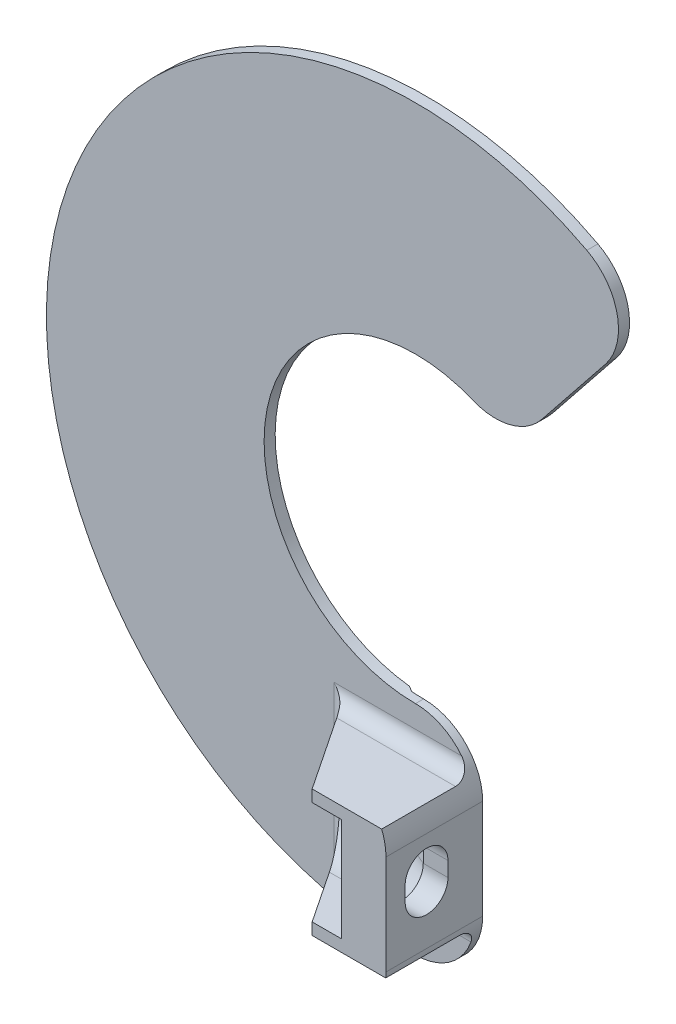
from build123d import *

# Parameters (mm, degrees)
BASE_FLANGE_DEPTH          = 0.75
MOUNT_PEG_DEPTH            = 3
SKETCH4_W                  = 5
SKETCH4_H                  = 8.6
SCREW_BOSS_DEPTH           = 6
SCREW_BOSS_CHAMFER_DEPTH   = 8.6
SCREW_START                = -3
SCREW_BOSS_CLEARANCE_DEPTH = 36.87881814
M2_5_START                 = 1
M2_5_CLEARANCE_SLOT1_DEPTH = 3
PEG_CHAMFER_SIZE           = 0.5
FILLET1_R                  = 1
FILLET2_R                  = 4
SKETCH9_W                  = 5.5
SKETCH9_H                  = 16.180617206
CUT_EXTRUDE1_DEPTH         = 0.2
CHAMFER1_SIZE              = 0.692820323
CHAMFER1_SIZE_2            = 0.4


with BuildPart() as part:
    # Sketch1 → base flange (new body)
    with BuildSketch(Plane.XY):
        with BuildLine():
            Line((4, -24.677925359), (4, -9.442398166))
            ThreePointArc((4, -9.442398166), (-10.158758778, 1.399465338), (6.404113855, 8.009132841))
            Line((6.404113855, 8.009132841), (15.612630109, 19.525516154))
            ThreePointArc((15.612630109, 19.525516154), (-24.179534225, 6.352174798), (4, -24.677925359))
        make_face()
    extrude(amount=BASE_FLANGE_DEPTH)

    # Sketch3 → mount peg (add)
    with BuildSketch(Plane(origin=(0, 0, 0), x_dir=(-1, 0, 0), z_dir=(0, 0, -1))):
        with BuildLine():
            Line((9.575, -19), (9.575, -12))
            ThreePointArc((9.575, -12), (10.75, -10.825), (11.925, -12))
            Line((11.925, -12), (11.925, -19))
            ThreePointArc((11.925, -19), (10.75, -20.175), (9.575, -19))
        make_face()
    extrude(amount=MOUNT_PEG_DEPTH)

    # Sketch4 → screw boss (add)
    with BuildSketch(Plane.XY.offset(0.75)):
        with Locations((1.5, -17.060161762)):
            Rectangle(SKETCH4_W, SKETCH4_H)
    extrude(amount=SCREW_BOSS_DEPTH)

    # Sketch5 → screw boss chamfer (add)
    with BuildSketch(Plane.XZ.offset(21.360161762)):
        Polygon((-1, 0.75), (-1, 6.75), (-5, 0.75), align=None)
    extrude(amount=-SCREW_BOSS_CHAMFER_DEPTH)

    # Sketch6 → screw boss clearance (cut, through all)
    with BuildSketch(Plane(origin=(4, 0, 0), x_dir=(0, 0, -1), z_dir=(1, 0, 0)).offset(SCREW_START)):
        with BuildLine():
            Line((-6.75, -20.560161762), (-3.25, -20.560161762))
            ThreePointArc((-3.25, -20.560161762), (-1.835786438, -19.974375325), (-1.25, -18.560161762))
            Line((-1.25, -18.560161762), (-1.25, -15.560161762))
            ThreePointArc((-1.25, -15.560161762), (-1.835786438, -14.1459482), (-3.25, -13.560161762))
            Line((-3.25, -13.560161762), (-6.75, -13.560161762))
            Line((-6.75, -13.560161762), (-6.75, -20.560161762))
        make_face()
    extrude(amount=-SCREW_BOSS_CLEARANCE_DEPTH, mode=Mode.SUBTRACT)

    # M2.5 Clearance Slot1: read off the stored shape, not the designer's step
    # M2.5 Clearance Slot1 outline → M2.5 Clearance Slot1 (cut)
    with BuildSketch(Plane.YZ.offset(M2_5_START)):
        with BuildLine():
            ThreePointArc((-17.560161762, 5.45), (-19.010161762, 4), (-17.560161762, 2.55))
            Line((-17.560161762, 2.55), (-16.560161762, 2.55))
            ThreePointArc((-16.560161762, 2.55), (-15.110161762, 4), (-16.560161762, 5.45))
            Line((-16.560161762, 5.45), (-17.560161762, 5.45))
        make_face()
    extrude(amount=M2_5_CLEARANCE_SLOT1_DEPTH, mode=Mode.SUBTRACT)

    # M2.5 Clearance Slot1 2: loft between two sections, ruled curve by curve
    m2_5_clearance_slot1_2_from = [
        Edge.make_three_point_arc((2.327817459, -16.560161762, 5.45), (2.327817459, -15.53485693, 5.025304833), (2.327817459, -15.110161762, 4)),
        Edge.make_three_point_arc((2.327817459, -15.110161762, 4), (2.327817459, -15.53485693, 2.974695167), (2.327817459, -16.560161762, 2.55)),
        Edge.make_three_point_arc((2.327817459, -17.560161762, 2.55), (2.327817459, -18.585466595, 2.974695167), (2.327817459, -19.010161762, 4)),
        Edge.make_three_point_arc((2.327817459, -19.010161762, 4), (2.327817459, -18.585466595, 5.025304833), (2.327817459, -17.560161762, 5.45)),
        Edge.make_line((2.327817459, -16.560161762, 2.55), (2.327817459, -17.560161762, 2.55)),
        Edge.make_line((2.327817459, -16.560161762, 5.45), (2.327817459, -17.560161762, 5.45)),
    ]
    m2_5_clearance_slot1_2_to = [
        Edge.make_three_point_arc((1, -16.560161762, 6), (1, -15.1459482, 5.414213562), (1, -14.560161762, 4)),
        Edge.make_three_point_arc((1, -14.560161762, 4), (1, -15.1459482, 2.585786438), (1, -16.560161762, 2)),
        Edge.make_three_point_arc((1, -17.560161762, 2), (1, -18.974375325, 2.585786438), (1, -19.560161762, 4)),
        Edge.make_three_point_arc((1, -19.560161762, 4), (1, -18.974375325, 5.414213562), (1, -17.560161762, 6)),
        Edge.make_line((1, -16.560161762, 2), (1, -17.560161762, 2)),
        Edge.make_line((1, -16.560161762, 6), (1, -17.560161762, 6)),
    ]
    m2_5_clearance_slot1_2 = Solid(Shell([*[Face.make_surface_from_curves(m2_5_clearance_slot1_2_from[k], m2_5_clearance_slot1_2_to[k]) for k in range(6)], Face(Wire(m2_5_clearance_slot1_2_from)), Face(Wire(m2_5_clearance_slot1_2_to))]))
    add(m2_5_clearance_slot1_2, mode=Mode.SUBTRACT)

    # peg chamfer
    peg_chamfer_edges = [part.edges().sort_by_distance(p)[0] for p in [
        (-10.75, -20.175, -3),
        (-11.925, -15.5, -3),
        (-10.75, -10.825, -3),
        (-9.575, -15.5, -3),
    ]]
    chamfer(peg_chamfer_edges, length=PEG_CHAMFER_SIZE)

    # Fillet1
    fillet1_edges = [part.edges().sort_by_distance(p)[0] for p in [
        (-0.5, -12.760161762, 0.75),
        (-0.5, -21.360161762, 0.75),
        (-5, -17.060161762, 0.75),
    ]]
    fillet(fillet1_edges, radius=FILLET1_R)

    # Fillet2
    fillet2_edges = [part.edges().sort_by_distance(p)[0] for p in [
        (4, -9.442398166, 0.375),
        (4, -24.677925359, 0.375),
        (15.612630109, 19.525516154, 0.375),
        (6.404113855, 8.009132841, 0.375),
    ]]
    fillet(fillet2_edges, radius=FILLET2_R)

    # Sketch9 → Cut-Extrude1 (cut)
    with BuildSketch(Plane(origin=(0, 0, 0), x_dir=(-1, 0, 0), z_dir=(0, 0, -1))):
        with Locations((-1.25, -17.718085194)):
            Rectangle(SKETCH9_W, SKETCH9_H)
    extrude(amount=-CUT_EXTRUDE1_DEPTH, mode=Mode.SUBTRACT)

    # Chamfer1
    # the kernel refuses this chamfer: 0.692820323, 0.4 mm, written as the material it adds along each edge
    with BuildSketch(Plane(origin=(-1.5, -26.747345015, 0.2), x_dir=(1, 0, 0), z_dir=(0, 1, 0))) as chamfer1_piece_1_section:
        Polygon((CHAMFER1_SIZE, 0), (0, CHAMFER1_SIZE_2), (0, 0), align=None)
    chamfer1_piece_1 = extrude(amount=18.395329037, mode=Mode.PRIVATE)
    chamfer1_piece_1 = chamfer1_piece_1 & Plane(origin=(0, 0, 0.2), x_dir=(0.6245052043696531, 0.7810206461516994, 0), z_dir=(0, 0, -1)) * Cylinder(25, 40, mode=Mode.PRIVATE)
    chamfer1_piece_1 = chamfer1_piece_1 - Plane(origin=(0, 0, 0.2), x_dir=(0.39006502286727884, -0.9207873141695369, 0), z_dir=(0, 0, -1)) * Cylinder(10.254700538, 40, mode=Mode.PRIVATE)
    chamfer1_piece_1 = split(chamfer1_piece_1, bisect_by=Plane(origin=(-1.5, -26.747345015, 0), z_dir=(0, 0, 1)), keep=Keep.TOP, mode=Mode.PRIVATE)
    add(chamfer1_piece_1)


solid = part.part
